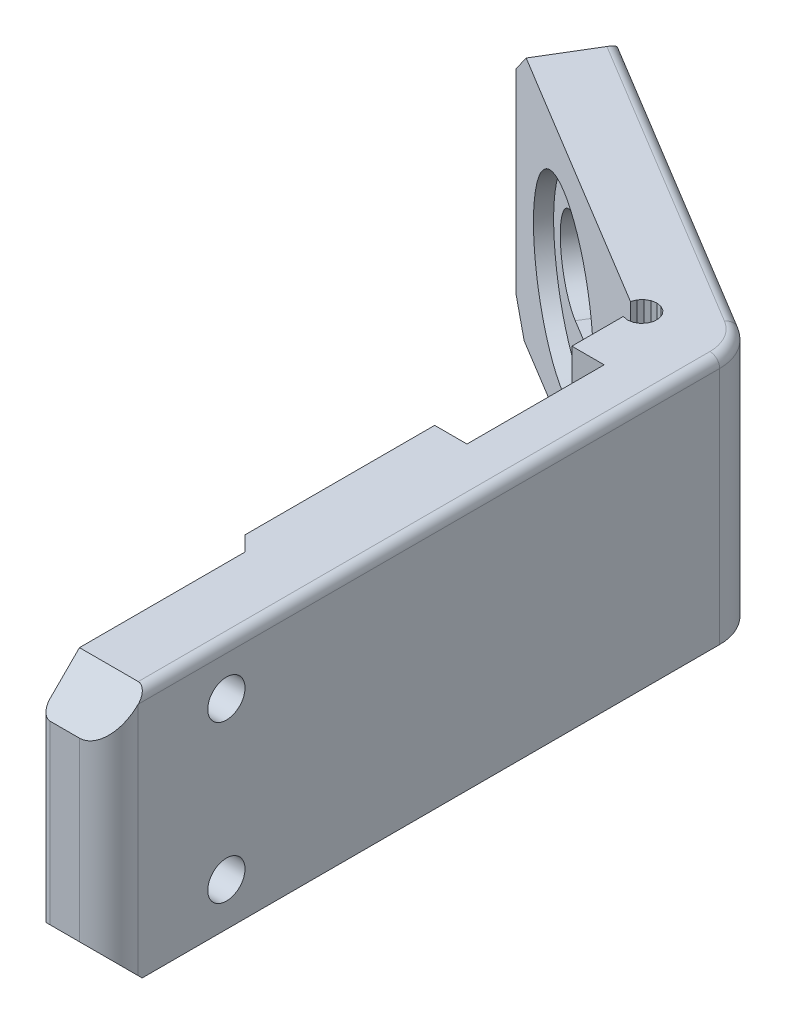
from build123d import *

# Parameters (mm, degrees)
LEG_AND_PAD_DEPTH          = 13
SCREW_HEAD_RELIEF_SKETCH_W = 14
SCREW_HEAD_RELIEF_SKETCH_H = 6
SCREW_HEAD_RELIEF_DEPTH    = 2.35
M6_SLOT_MIDDLE_DEPTH       = 4.5
SCREW_HOLES_SKETCH_R       = 1.9
SCREW_HOLES_DEPTH          = 4.5
LEG_TOP_CORNERS_SIZE       = 4
PAD_END_CORNERS_SIZE       = 4
OUTSIDE_OF_THE_BEND_R      = 5
LEG_TOP_OUTER_EDGE_R       = 3
PAD_END_OUTER_EDGE_R       = 3
LEG_TOP_INNER_EDGE_R       = 1
PAD_END_INNER_EDGE_R       = 1
BED_FACE_CHAMFER_SIZE      = 0.6
TOP_FACE_EDGE_R            = 1


with BuildPart() as part:
    # leg and pad sketch → leg and pad (new, symmetric)
    with BuildSketch(Plane(origin=(0, -20.7, 0), x_dir=(1, 0, 0), z_dir=(0, 1, 0))):
        Polygon((-0.551289683, 30.332713936), (-0.367250577, 30.819395741), (-0.028023026, 31.213926146), (0.425575667, 31.468833575), (0.938966578, 31.553446481), (1.450376329, 31.457583879), (1.898269923, 31.192780366), (2.228754897, 30.790898227), (2.402065893, 30.30029363), (2.397349395, 29.779998208), (2.215172912, 29.292616119), (1.877456693, 28.896791249), (1.424836191, 28.640150931), (0.91177263, 28.55357522), (0.4, 28.647481273), (0.4, -9.98), (1.92, -11.5), (1.92, -32.37), (8.92, -32.37), (8.92, 32.792642706), (-27.204821487, 54.594667874), (-30.821788068, 48.601542416), align=None)
    extrude(amount=LEG_AND_PAD_DEPTH, both=True)

    # screw head relief sketch → screw head relief (cut, symmetric)
    with BuildSketch(Plane(origin=(1.35, 0, 0), x_dir=(0, 0, -1), z_dir=(1, 0, 0))):
        with Locations((16.4, -9.7)):
            Rectangle(SCREW_HEAD_RELIEF_SKETCH_W, SCREW_HEAD_RELIEF_SKETCH_H)
    extrude(amount=SCREW_HEAD_RELIEF_DEPTH, both=True, mode=Mode.SUBTRACT)

    # insert flange relief sketch → insert flange relief (revolve, cut)
    with BuildSketch(Plane(origin=(0, -20.7, 0), x_dir=(1, 0, 0), z_dir=(0, 1, 0))):
        Polygon((-18.324853729, 39.891397061), (-17.03307995, 42.03179901), (-9.327632933, 37.381413406), (-10.619406712, 35.241011457), align=None)
    revolve(axis=Axis((-18.324853729, -20.7, -39.891397061), (0.5167095115681243, 0, -0.8561607796757748)), mode=Mode.SUBTRACT)

    # M6 slot end 1 sketch → M6 slot end 1 (revolve, cut)
    with BuildSketch(Plane(origin=(0, -20.7, 0), x_dir=(1, 0, 0), z_dir=(0, 1, 0))):
        Polygon((-20.465255678, 41.18317084), (-15.814870074, 48.888617857), (-11.962146565, 46.563425055), (-16.612532169, 38.857978038), align=None)
    revolve(axis=Axis((-20.465255678, -20.7, -41.18317084), (0.5167095115681236, 0, -0.8561607796757752)), mode=Mode.SUBTRACT)

    # M6 slot end 2 sketch → M6 slot end 2 (revolve, cut)
    with BuildSketch(Plane(origin=(0, -20.7, 0), x_dir=(1, 0, 0), z_dir=(0, 1, 0))):
        Polygon((-16.18445178, 38.599623282), (-11.534066176, 46.305070299), (-7.681342667, 43.979877497), (-12.331728271, 36.27443048), align=None)
    revolve(axis=Axis((-16.18445178, -20.7, -38.599623282), (0.5167095115681234, 0, -0.8561607796757752)), mode=Mode.SUBTRACT)

    # M6 slot middle sketch → M6 slot middle (cut, symmetric)
    with BuildSketch(Plane(origin=(0, -20.7, 0), x_dir=(1, 0, 0), z_dir=(0, 1, 0))):
        Polygon((-16.18445178, 38.599623282), (-20.465255678, 41.18317084), (-15.814870074, 48.888617857), (-11.534066176, 46.305070299), align=None)
    extrude(amount=M6_SLOT_MIDDLE_DEPTH, both=True, mode=Mode.SUBTRACT)

    # screw holes sketch → screw holes (cut, symmetric)
    with BuildSketch(Plane(origin=(5.42, 0, 0), x_dir=(0, 0, -1), z_dir=(1, 0, 0))):
        with Locations((-20.375, -28.7)):
            Circle(SCREW_HOLES_SKETCH_R)
        with Locations((-20.375, -12.7)):
            Circle(SCREW_HOLES_SKETCH_R)
    extrude(amount=SCREW_HOLES_DEPTH, both=True, mode=Mode.SUBTRACT)

    # leg top corners
    leg_top_corners_edges = [part.edges().sort_by_distance(p)[0] for p in [
        (5.42, -7.7, 32.37),
        (5.42, -33.7, 32.37),
    ]]
    chamfer(leg_top_corners_edges, length=LEG_TOP_CORNERS_SIZE)

    # pad end corners
    pad_end_corners_edges = [part.edges().sort_by_distance(p)[0] for p in [
        (-29.013304778, -7.7, -51.598105145),
        (-29.013304778, -33.7, -51.598105145),
    ]]
    chamfer(pad_end_corners_edges, length=PAD_END_CORNERS_SIZE)

    # outside of the bend
    outside_of_the_bend_edges = [part.edges().sort_by_distance(p)[0] for p in [
        (8.92, -20.7, -32.792642706),
    ]]
    fillet(outside_of_the_bend_edges, radius=OUTSIDE_OF_THE_BEND_R)

    # leg top outer edge
    leg_top_outer_edge_edges = [part.edges().sort_by_distance(p)[0] for p in [
        (8.92, -20.7, 32.37),
    ]]
    fillet(leg_top_outer_edge_edges, radius=LEG_TOP_OUTER_EDGE_R)

    # pad end outer edge
    pad_end_outer_edge_edges = [part.edges().sort_by_distance(p)[0] for p in [
        (-27.204821487, -20.7, -54.594667874),
    ]]
    fillet(pad_end_outer_edge_edges, radius=PAD_END_OUTER_EDGE_R)

    # leg top inner edge
    leg_top_inner_edge_edges = [part.edges().sort_by_distance(p)[0] for p in [
        (1.92, -20.7, 32.37),
    ]]
    fillet(leg_top_inner_edge_edges, radius=LEG_TOP_INNER_EDGE_R)

    # pad end inner edge
    pad_end_inner_edge_edges = [part.edges().sort_by_distance(p)[0] for p in [
        (-30.821788068, -20.7, -48.601542416),
    ]]
    fillet(pad_end_inner_edge_edges, radius=PAD_END_INNER_EDGE_R)

    # bed face chamfer
    bed_face_chamfer_edges = [part.edges().sort_by_distance(p)[0] for p in [
        (-13.974217317, -33.7, -38.433709153),
        (-8.638315405, -33.7, -43.38942405),
        (1.92, -33.7, 19.935),
        (0.4, -33.7, -9.333740636),
        (8.274178326, -33.7, -32.428085628),
        (8.92, -33.7, -0.800107187),
    ]]
    chamfer(bed_face_chamfer_edges, length=BED_FACE_CHAMFER_SIZE)

    # top face edge
    top_face_edge_edges = [part.edges().sort_by_distance(p)[0] for p in [
        (-8.638315405, -7.7, -43.38942405),
        (8.274178326, -7.7, -32.428085628),
        (8.92, -7.7, -0.800107187),
    ]]
    fillet(top_face_edge_edges, radius=TOP_FACE_EDGE_R)


solid = part.part
